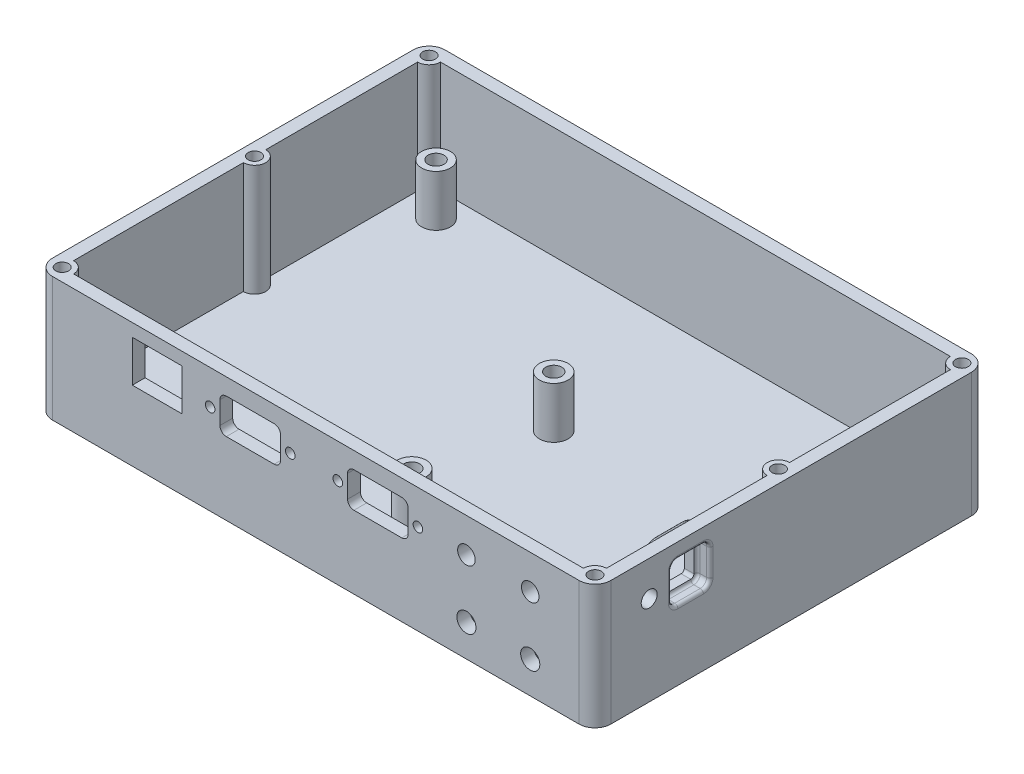
from build123d import *

# Parameters (mm, degrees)
IZIM1_W                     = 175
IZIM1_H                     = 123
Y_KSEKLIK_EKSTR_ZYON1_DEPTH = 4
IZIM2_W                     = 175
IZIM2_H                     = 123
IZIM2_W_2                   = 167
IZIM2_H_2                   = 115
Y_KSEKLIK_EKSTR_ZYON2_DEPTH = 35
IZIM3_R                     = 1.5
IZIM3_R_2                   = 2.75
IZIM3_R_3                   = 3
IZIM3_W                     = 15.5
IZIM3_H                     = 13
KES_EKSTR_ZYON1_DEPTH       = 10
IZIM5_R                     = 2.5
KES_EKSTR_ZYON3_DEPTH       = 5
RADYUS1_R                   = 5
IZIM6_R                     = 4.5
IZIM6_R_2                   = 2.5
Y_KSEKLIK_EKSTR_ZYON3_DEPTH = 16
IZIM7_R                     = 2
KES_EKSTR_ZYON4_DEPTH       = 15
Y_KSEKLIK_EKSTR_ZYON4_REACH = 115.84
IZIM8_R                     = 3.585786438
IZIM8_R_2                   = 2
IZIM8_R_3                   = 3.5
Y_KSEKLIK_EKSTR_ZYON5_DEPTH = 3
RADYUS2_R                   = 1
RADYUS3_R                   = 1
RADYUS4_R                   = 1


with BuildPart() as part:
    # Çizim1 → Yükseklik-Ekstrüzyon1 (new body)
    with BuildSketch(Plane(origin=(0, 0, 0), x_dir=(1, 0, 0), z_dir=(0, 1, 0))):
        Rectangle(IZIM1_W, IZIM1_H)
    extrude(amount=Y_KSEKLIK_EKSTR_ZYON1_DEPTH)

    # Çizim2 → Yükseklik-Ekstrüzyon2 (add)
    with BuildSketch(Plane(origin=(0, 4, 0), x_dir=(1, 0, 0), z_dir=(0, 1, 0))):
        Rectangle(IZIM2_W, IZIM2_H)
        Rectangle(IZIM2_W_2, IZIM2_H_2, mode=Mode.SUBTRACT)
    extrude(amount=Y_KSEKLIK_EKSTR_ZYON2_DEPTH)

    # Çizim3 → Kes-Ekstrüzyon1 (cut)
    with BuildSketch(Plane.XY.offset(61.5)):
        with Locations((-33.1, 28.27478079)):
            Circle(IZIM3_R)
        with Locations((-7.99, 28.27478079)):
            Circle(IZIM3_R)
        with Locations((6.9, 28.27478079)):
            Circle(IZIM3_R)
        with Locations((32.01, 28.27478079)):
            Circle(IZIM3_R)
        with Locations((47.212067108, 28.27478079)):
            Circle(IZIM3_R_2)
        with Locations((67.212067108, 28.27478079)):
            Circle(IZIM3_R_2)
        with Locations((47.212067108, 10)):
            Circle(IZIM3_R_3)
        with Locations((67.212067108, 10)):
            Circle(IZIM3_R_3)
        with Locations((-49.75, 28.5)):
            Rectangle(IZIM3_W, IZIM3_H)
        with BuildLine():
            Line((-28.045, 33.77478079), (-13.045, 33.77478079))
            ThreePointArc((-13.045, 33.77478079), (-11.630786438, 33.188994352), (-11.045, 31.77478079))
            Line((-11.045, 31.77478079), (-11.045, 24.77478079))
            ThreePointArc((-11.045, 24.77478079), (-11.630786438, 23.360567228), (-13.045, 22.77478079))
            Line((-13.045, 22.77478079), (-28.045, 22.77478079))
            ThreePointArc((-28.045, 22.77478079), (-29.459213562, 23.360567228), (-30.045, 24.77478079))
            Line((-30.045, 24.77478079), (-30.045, 31.77478079))
            ThreePointArc((-30.045, 31.77478079), (-29.459213562, 33.188994352), (-28.045, 33.77478079))
        make_face()
        with BuildLine():
            Line((11.96, 33.77478079), (26.96, 33.77478079))
            ThreePointArc((26.96, 33.77478079), (28.374213562, 33.188994352), (28.96, 31.77478079))
            Line((28.96, 31.77478079), (28.96, 24.77478079))
            ThreePointArc((28.96, 24.77478079), (28.374213562, 23.360567228), (26.96, 22.77478079))
            Line((26.96, 22.77478079), (11.96, 22.77478079))
            ThreePointArc((11.96, 22.77478079), (10.545786438, 23.360567228), (9.96, 24.77478079))
            Line((9.96, 24.77478079), (9.96, 31.77478079))
            ThreePointArc((9.96, 31.77478079), (10.545786438, 33.188994352), (11.96, 33.77478079))
        make_face()
    extrude(amount=-KES_EKSTR_ZYON1_DEPTH, mode=Mode.SUBTRACT)

    # Çizim5 → Kes-Ekstrüzyon3 (cut)
    with BuildSketch(Plane(origin=(87.5, 0, 0), x_dir=(0, 0, -1), z_dir=(1, 0, 0))):
        with Locations((-44.5, 28)):
            Circle(IZIM5_R)
        with BuildLine():
            Line((-35.5, 21.809976004), (-27.5, 21.809976004))
            ThreePointArc((-27.5, 21.809976004), (-26.085786438, 22.395762442), (-25.5, 23.809976004))
            Line((-25.5, 23.809976004), (-25.5, 32.246181166))
            ThreePointArc((-25.5, 32.246181166), (-26.085786438, 33.660394728), (-27.5, 34.246181166))
            Line((-27.5, 34.246181166), (-35.5, 34.246181166))
            ThreePointArc((-35.5, 34.246181166), (-36.914213562, 33.660394728), (-37.5, 32.246181166))
            Line((-37.5, 32.246181166), (-37.5, 23.809976004))
            ThreePointArc((-37.5, 23.809976004), (-36.914213562, 22.395762442), (-35.5, 21.809976004))
        make_face()
    extrude(amount=-KES_EKSTR_ZYON3_DEPTH, mode=Mode.SUBTRACT)

    # Radyus1
    radyus1_edges = [part.edges().sort_by_distance(p)[0] for p in [
        (-87.5, 19.5, -61.5),
        (87.5, 19.5, -61.5),
        (87.5, 19.5, 61.5),
        (-87.5, 19.5, 61.5),
    ]]
    fillet(radyus1_edges, radius=RADYUS1_R)

    # Çizim6 → Yükseklik-Ekstrüzyon3 (add)
    # profile 1 of 6: a face of its own
    with BuildSketch(Plane(origin=(0, 4, 0), x_dir=(1, 0, 0), z_dir=(0, 1, 0))):
        with Locations((77.395, -55.31)):
            Circle(IZIM6_R)
        with Locations((77.395, -55.31)):
            Circle(IZIM6_R_2, mode=Mode.SUBTRACT)
    # profile 2 of 6: a face of its own
    with BuildSketch(Plane(origin=(0, 4, 0), x_dir=(1, 0, 0), z_dir=(0, 1, 0))):
        with Locations(Location((-73.105, 49.29, 0), (0, 0, 90))):
            Circle(IZIM6_R)
        with Locations(Location((-73.105, 49.29, 0), (0, 0, 270))):
            Circle(IZIM6_R_2, mode=Mode.SUBTRACT)
    # profile 3 of 6: a face of its own
    with BuildSketch(Plane(origin=(0, 4, 0), x_dir=(1, 0, 0), z_dir=(0, 1, 0))):
        with Locations(Location((76.895, 49.19, 0), (0, 0, 90))):
            Circle(IZIM6_R)
        with Locations(Location((76.895, 49.19, 0), (0, 0, 270))):
            Circle(IZIM6_R_2, mode=Mode.SUBTRACT)
    # profile 4 of 6: a face of its own
    with BuildSketch(Plane(origin=(0, 4, 0), x_dir=(1, 0, 0), z_dir=(0, 1, 0))):
        with Locations(Location((2.895, 10.19, 0), (0, 0, 90))):
            Circle(IZIM6_R)
        with Locations(Location((2.895, 10.19, 0), (0, 0, 270))):
            Circle(IZIM6_R_2, mode=Mode.SUBTRACT)
    # profile 5 of 6: a face of its own
    with BuildSketch(Plane(origin=(0, 4, 0), x_dir=(1, 0, 0), z_dir=(0, 1, 0))):
        with Locations(Location((6.895, -38.31, 0), (0, 0, 90))):
            Circle(IZIM6_R)
        with Locations(Location((6.895, -38.31, 0), (0, 0, 270))):
            Circle(IZIM6_R_2, mode=Mode.SUBTRACT)
    # profile 6 of 6: a face of its own
    with BuildSketch(Plane(origin=(0, 4, 0), x_dir=(1, 0, 0), z_dir=(0, 1, 0))):
        with BuildLine():
            Line((-83.5, -54.372286737), (-83.5, -51.881755604))
            ThreePointArc((-83.5, -51.881755604), (-76.813866303, -51.823469652), (-73.280484881, -57.5))
            Line((-73.280484881, -57.5), (-75.283403016, -57.5))
            ThreePointArc((-75.283403016, -57.5), (-78.386150879, -53.294531566), (-83.5, -54.372286737))
        make_face()
    extrude(amount=Y_KSEKLIK_EKSTR_ZYON3_DEPTH)

    # Çizim7 → Kes-Ekstrüzyon4 (cut)
    with BuildSketch(Plane(origin=(0, 39, 0), x_dir=(1, 0, 0), z_dir=(0, 1, 0))):
        with Locations((-83.5, 57.5)):
            Circle(IZIM7_R)
        with Locations((83.5, 57.5)):
            Circle(IZIM7_R)
        with Locations((83.5, -57.5)):
            Circle(IZIM7_R)
        with Locations((-83.5, -57.5)):
            Circle(IZIM7_R)
        with Locations((-83.5, 2.809122198)):
            Circle(IZIM7_R)
        with Locations((83.5, 0)):
            Circle(IZIM7_R)
    extrude(amount=-KES_EKSTR_ZYON4_DEPTH, mode=Mode.SUBTRACT)

    # Çizim8 → Yükseklik-Ekstrüzyon4 (add, up to next)
    with BuildSketch(Plane(origin=(0, 39, 0), x_dir=(1, 0, 0), z_dir=(0, 1, 0)), mode=Mode.PRIVATE) as y_kseklik_ekstr_zyon4_sk1:
        with Locations((-83.5, 57.5)):
            Circle(IZIM8_R)
        with Locations(Location((-83.5, 57.5, 0), (0, 0, 270))):
            Circle(IZIM8_R_2, mode=Mode.SUBTRACT)
    y_kseklik_ekstr_zyon4_tool1 = extrude(y_kseklik_ekstr_zyon4_sk1.sketch, amount=-Y_KSEKLIK_EKSTR_ZYON4_REACH, mode=Mode.PRIVATE) - part.part
    # Çizim8 → Yükseklik-Ekstrüzyon4 (add, up to next)
    with BuildSketch(Plane(origin=(0, 39, 0), x_dir=(1, 0, 0), z_dir=(0, 1, 0)), mode=Mode.PRIVATE) as y_kseklik_ekstr_zyon4_sk2:
        with Locations((-83.5, -57.5)):
            Circle(IZIM8_R)
        with Locations(Location((-83.5, -57.5, 0), (0, 0, 270))):
            Circle(IZIM8_R_2, mode=Mode.SUBTRACT)
    y_kseklik_ekstr_zyon4_tool2 = extrude(y_kseklik_ekstr_zyon4_sk2.sketch, amount=-Y_KSEKLIK_EKSTR_ZYON4_REACH, mode=Mode.PRIVATE) - part.part
    # Çizim8 → Yükseklik-Ekstrüzyon4 (add, up to next)
    with BuildSketch(Plane(origin=(0, 39, 0), x_dir=(1, 0, 0), z_dir=(0, 1, 0)), mode=Mode.PRIVATE) as y_kseklik_ekstr_zyon4_sk3:
        with Locations((83.5, -57.5)):
            Circle(IZIM8_R)
        with Locations(Location((83.5, -57.5, 0), (0, 0, 270))):
            Circle(IZIM8_R_2, mode=Mode.SUBTRACT)
    y_kseklik_ekstr_zyon4_tool3 = extrude(y_kseklik_ekstr_zyon4_sk3.sketch, amount=-Y_KSEKLIK_EKSTR_ZYON4_REACH, mode=Mode.PRIVATE) - part.part
    # Çizim8 → Yükseklik-Ekstrüzyon4 (add, up to next)
    with BuildSketch(Plane(origin=(0, 39, 0), x_dir=(1, 0, 0), z_dir=(0, 1, 0)), mode=Mode.PRIVATE) as y_kseklik_ekstr_zyon4_sk4:
        with Locations((83.5, 0)):
            Circle(IZIM8_R_3)
        with Locations(Location((83.5, 0, 0), (0, 0, 270))):
            Circle(IZIM8_R_2, mode=Mode.SUBTRACT)
    y_kseklik_ekstr_zyon4_tool4 = extrude(y_kseklik_ekstr_zyon4_sk4.sketch, amount=-Y_KSEKLIK_EKSTR_ZYON4_REACH, mode=Mode.PRIVATE) - part.part
    # Çizim8 → Yükseklik-Ekstrüzyon4 (add, up to next)
    with BuildSketch(Plane(origin=(0, 39, 0), x_dir=(1, 0, 0), z_dir=(0, 1, 0)), mode=Mode.PRIVATE) as y_kseklik_ekstr_zyon4_sk5:
        with Locations((-83.5, 2.809122198)):
            Circle(IZIM8_R_3)
        with Locations(Location((-83.5, 2.809122198, 0), (0, 0, 270))):
            Circle(IZIM8_R_2, mode=Mode.SUBTRACT)
    y_kseklik_ekstr_zyon4_tool5 = extrude(y_kseklik_ekstr_zyon4_sk5.sketch, amount=-Y_KSEKLIK_EKSTR_ZYON4_REACH, mode=Mode.PRIVATE) - part.part
    # Çizim8 → Yükseklik-Ekstrüzyon4 (add, up to next)
    with BuildSketch(Plane(origin=(0, 39, 0), x_dir=(1, 0, 0), z_dir=(0, 1, 0)), mode=Mode.PRIVATE) as y_kseklik_ekstr_zyon4_sk6:
        with Locations((83.5, 57.5)):
            Circle(IZIM8_R)
        with Locations(Location((83.5, 57.5, 0), (0, 0, 270))):
            Circle(IZIM8_R_2, mode=Mode.SUBTRACT)
    y_kseklik_ekstr_zyon4_tool6 = extrude(y_kseklik_ekstr_zyon4_sk6.sketch, amount=-Y_KSEKLIK_EKSTR_ZYON4_REACH, mode=Mode.PRIVATE) - part.part
    add(y_kseklik_ekstr_zyon4_tool1.solids().sort_by_distance((-86.984365, 39, -57.5))[0])
    add(y_kseklik_ekstr_zyon4_tool2.solids().sort_by_distance((-86.984365, 39, 57.5))[0])
    add(y_kseklik_ekstr_zyon4_tool3.solids().sort_by_distance((80.015635, 39, 57.5))[0])
    add(y_kseklik_ekstr_zyon4_tool4.solids().sort_by_distance((80.098995, 39, 0))[0])
    add(y_kseklik_ekstr_zyon4_tool5.solids().sort_by_distance((-86.901005, 39, -2.809122))[0])
    add(y_kseklik_ekstr_zyon4_tool6.solids().sort_by_distance((80.015635, 39, -57.5))[0])

    # Çizim9 → Yükseklik-Ekstrüzyon5 (add)
    with BuildSketch(Plane.ZY.offset(-83.5)):
        with BuildLine():
            Line((22.5, 32.246181166), (22.5, 23.809976004))
            ThreePointArc((22.5, 23.809976004), (23.964466094, 20.274442098), (27.5, 18.809976004))
            Line((27.5, 18.809976004), (35.5, 18.809976004))
            ThreePointArc((35.5, 18.809976004), (39.035533906, 20.274442098), (40.5, 23.809976004))
            Line((40.5, 23.809976004), (40.5, 32.246181166))
            ThreePointArc((40.5, 32.246181166), (39.035533906, 35.781715072), (35.5, 37.246181166))
            Line((35.5, 37.246181166), (27.5, 37.246181166))
            ThreePointArc((27.5, 37.246181166), (23.964466094, 35.781715072), (22.5, 32.246181166))
        make_face()
        with BuildLine():
            Line((36.5, 23.809976004), (36.5, 32.246181166))
            ThreePointArc((36.5, 32.246181166), (36.207106781, 32.953287947), (35.5, 33.246181166))
            Line((35.5, 33.246181166), (27.5, 33.246181166))
            ThreePointArc((27.5, 33.246181166), (26.792893219, 32.953287947), (26.5, 32.246181166))
            Line((26.5, 32.246181166), (26.5, 23.809976004))
            ThreePointArc((26.5, 23.809976004), (26.792893219, 23.102869223), (27.5, 22.809976004))
            Line((27.5, 22.809976004), (35.5, 22.809976004))
            ThreePointArc((35.5, 22.809976004), (36.207106781, 23.102869223), (36.5, 23.809976004))
        make_face(mode=Mode.SUBTRACT)
    extrude(amount=Y_KSEKLIK_EKSTR_ZYON5_DEPTH)

    # Radyus2
    radyus2_edges = [part.edges().sort_by_distance(p)[0] for p in [
        (83.5, 21.809976004, 31.5),
        (83.5, 22.395762442, 26.085786438),
        (83.5, 28.028078585, 25.5),
        (83.5, 33.660394728, 26.085786438),
        (83.5, 34.246181166, 31.5),
        (83.5, 33.660394728, 36.914213562),
        (83.5, 28.028078585, 37.5),
        (83.5, 22.395762442, 36.914213562),
    ]]
    fillet(radyus2_edges, radius=RADYUS2_R - 0.0001)  # a hair under: the kernel refuses the full size

    # Radyus3
    radyus3_edges = [part.edges().sort_by_distance(p)[0] for p in [
        (80.5, 35.781715072, 23.964466094),
        (80.5, 28.028078585, 22.5),
        (80.5, 20.274442098, 23.964466094),
        (80.5, 18.809976004, 31.5),
        (80.5, 20.274442098, 39.035533906),
        (80.5, 28.028078585, 40.5),
        (80.5, 35.781715072, 39.035533906),
        (80.5, 37.246181166, 31.5),
    ]]
    fillet(radyus3_edges, radius=RADYUS3_R)

    # Radyus4
    radyus4_edges = [part.edges().sort_by_distance(p)[0] for p in [
        (87.5, 22.395762442, 36.914213562),
        (87.5, 21.809976004, 31.5),
        (87.5, 22.395762442, 26.085786438),
        (87.5, 28.028078585, 25.5),
        (87.5, 33.660394728, 26.085786438),
        (87.5, 34.246181166, 31.5),
        (87.5, 33.660394728, 36.914213562),
        (87.5, 28.028078585, 37.5),
    ]]
    fillet(radyus4_edges, radius=RADYUS4_R)


solid = part.part
